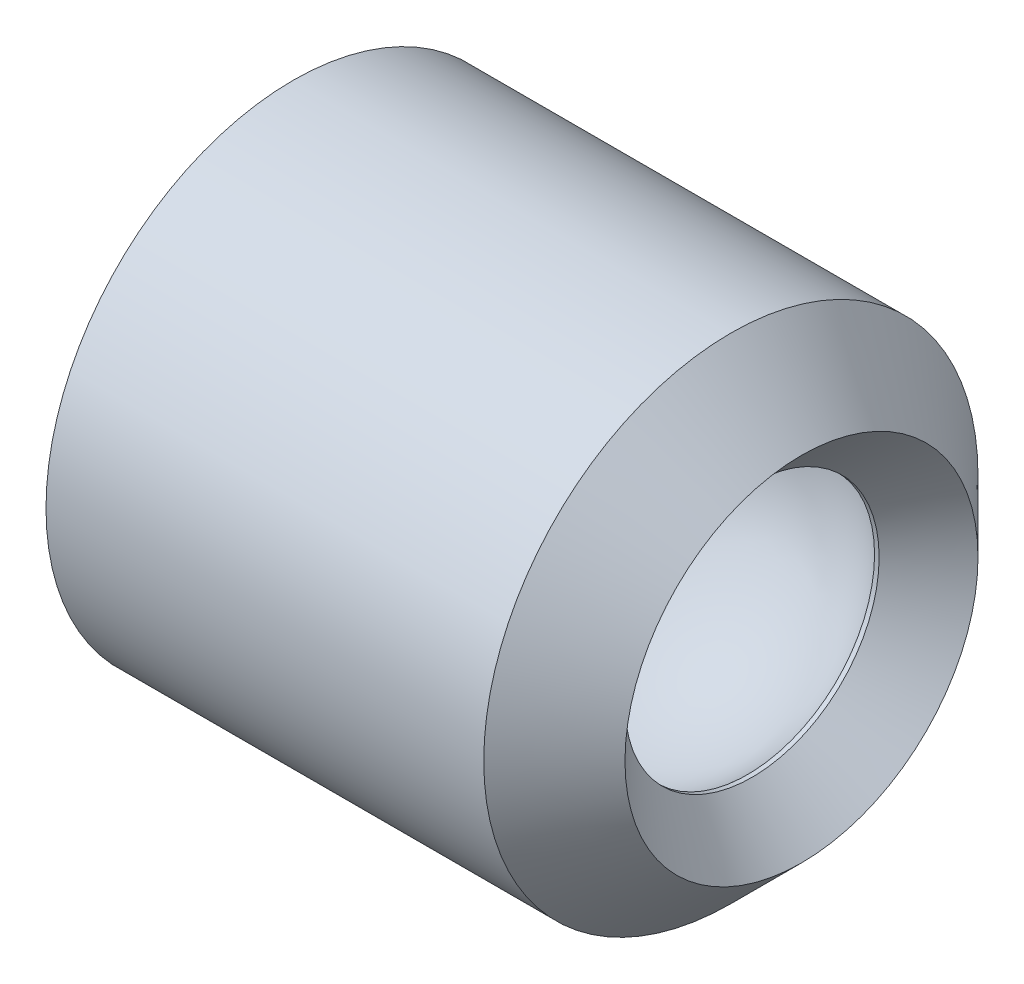
from build123d import *

# Parameters (mm, degrees)
SZKIC1_R                    = 17.5
DODANIE_WYCI_GNI_CIE1_DEPTH = 36
SZKIC2_R                    = 6
WYTNIJ_WYCI_GNI_CIE1_DEPTH  = 10
GWINT1_PITCH                = 1.5
SFAZOWANIE1_SIZE            = 5
SZKIC7_R                    = 9
WYTNIJ_WYCI_GNI_CIE2_DEPTH  = 11
SFAZOWANIE3_SIZE            = 3.5


with BuildPart() as part:
    # Szkic1 → Dodanie-wyciągnięcie1 (new body)
    with BuildSketch(Plane(origin=(0, 0, 0), x_dir=(0, 0, -1), z_dir=(1, 0, 0))):
        Circle(SZKIC1_R)
    extrude(amount=DODANIE_WYCI_GNI_CIE1_DEPTH)

    # Szkic2 → Wytnij-wyciągnięcie1 (cut)
    with BuildSketch(Plane.ZY):
        Circle(SZKIC2_R)
    extrude(amount=-WYTNIJ_WYCI_GNI_CIE1_DEPTH, mode=Mode.SUBTRACT)

    # Gwint1: arcs per turn and ends read off the stored shape
    # Gwint1: the profile of Profil gwintu1 profile screwed along a right-hand helix through 6.666667 turns, 8 arcs to a turn; built about Z, then put on its axis
    gwint1_z = Axis((0, 0, 0), (0, 0, 1))
    gwint1_corners = [(6.0003, 0, -0.000173205), (6.0003, 0, 1.312673201), (5.188101188, 0, 0.843749998), (5.188101188, 0, 0.468749998)]
    with BuildLine(mode=Mode.PRIVATE) as gwint1_profile:
        Line(gwint1_corners[0], gwint1_corners[1])
        Line(gwint1_corners[1], gwint1_corners[2])
        Line(gwint1_corners[2], gwint1_corners[3])
        Line(gwint1_corners[3], gwint1_corners[0])
    gwint1_cap = Face(gwint1_profile.wire())
    gwint1_turn_angles = [0, 22.5, 45, 67.5, 90, 112.5, 135, 157.5, 180, 202.5, 225, 247.5, 270, 292.5, 315, 337.5, 360]
    gwint1_turn_weights = [1, 0.9238795325112867, 1, 0.9238795325112867, 1, 0.9238795325112867, 1, 0.9238795325112867, 1, 0.9238795325112867, 1, 0.9238795325112867, 1, 0.9238795325112867, 1, 0.9238795325112867, 1]
    gwint1_turn_rails = [Edge.make_bspline([Vector(p[0], p[1], 0).rotate(gwint1_z, gwint1_turn_angles[k]) / gwint1_turn_weights[k] + Vector(0, 0, p[2] + GWINT1_PITCH * gwint1_turn_angles[k] / 360) for k in range(17)], [0, 0, 0, 1, 1, 2, 2, 3, 3, 4, 4, 5, 5, 6, 6, 7, 7, 8, 8, 8], 2, gwint1_turn_weights) for p in gwint1_corners]
    gwint1_turn_sides = [Face.make_surface_from_curves(gwint1_turn_rails[p[0]], gwint1_turn_rails[p[1]]) for p in [(0, 1), (1, 2), (2, 3), (3, 0)]]
    gwint1_last_angles = [2160, 2182.5, 2205, 2227.5, 2250, 2272.5, 2295, 2317.5, 2340, 2362.5, 2385, 2392.5, 2400]
    gwint1_last_weights = [1, 0.9238795325112867, 1, 0.9238795325112867, 1, 0.9238795325112867, 1, 0.9238795325112867, 1, 0.9238795325112867, 1, 0.9914448613738109, 1]
    gwint1_last_rails = [Edge.make_bspline([Vector(p[0], p[1], 0).rotate(gwint1_z, gwint1_last_angles[k]) / gwint1_last_weights[k] + Vector(0, 0, p[2] + GWINT1_PITCH * gwint1_last_angles[k] / 360) for k in range(13)], [0, 0, 0, 1, 1, 2, 2, 3, 3, 4, 4, 5, 5, 6, 6, 6], 2, gwint1_last_weights) for p in gwint1_corners]
    gwint1_last_sides = [Face.make_surface_from_curves(gwint1_last_rails[p[0]], gwint1_last_rails[p[1]]) for p in [(0, 1), (1, 2), (2, 3), (3, 0)]]
    gwint1 = Plane(origin=(0, 0, 0), x_dir=(0, 0, -1), z_dir=(1, 0, 0)) * Solid(Shell([*[p.moved(Location((0, 0, GWINT1_PITCH * i))) for i in range(6) for p in gwint1_turn_sides], *gwint1_last_sides, gwint1_cap, gwint1_cap.rotate(gwint1_z, 2400).moved(Location((0, 0, GWINT1_PITCH * 2400 / 360)))]))
    add(gwint1)

    # Sfazowanie1
    sfazowanie1_edges = [part.edges().sort_by_distance(p)[0] for p in [
        (36, 0, 17.5),
    ]]
    chamfer(sfazowanie1_edges, length=SFAZOWANIE1_SIZE)

    # Szkic7 → Wytnij-wyciągnięcie2 (cut)
    with BuildSketch(Plane(origin=(36, 0, 0), x_dir=(0, 0, -1), z_dir=(1, 0, 0))):
        Circle(SZKIC7_R)
    extrude(amount=-WYTNIJ_WYCI_GNI_CIE2_DEPTH, mode=Mode.SUBTRACT)

    # Sfazowanie3
    sfazowanie3_edges = [part.edges().sort_by_distance(p)[0] for p in [
        (36, 0, 9),
    ]]
    chamfer(sfazowanie3_edges, length=SFAZOWANIE3_SIZE - 0.0001)  # a hair under: the kernel refuses the full size

    # Szkic6 → Wycięcie-obrót13 (revolve, cut)
    with BuildSketch(Plane.XY):
        with BuildLine():
            Line((23.5, 12.5), (23.5, 0))
            Line((23.5, 0), (36, 0))
            ThreePointArc((36, 0), (32.338834765, 8.838834765), (23.5, 12.5))
        make_face()
        with BuildLine():
            Line((36, 0), (23.5, 0))
            Line((23.5, 0), (23.5, -12.5))
            ThreePointArc((23.5, -12.5), (32.338834765, -8.838834765), (36, 0))
        make_face()
    revolve(axis=Axis((23.5, 12.5, 0), (0, -1, 0)), mode=Mode.SUBTRACT)


solid = part.part
